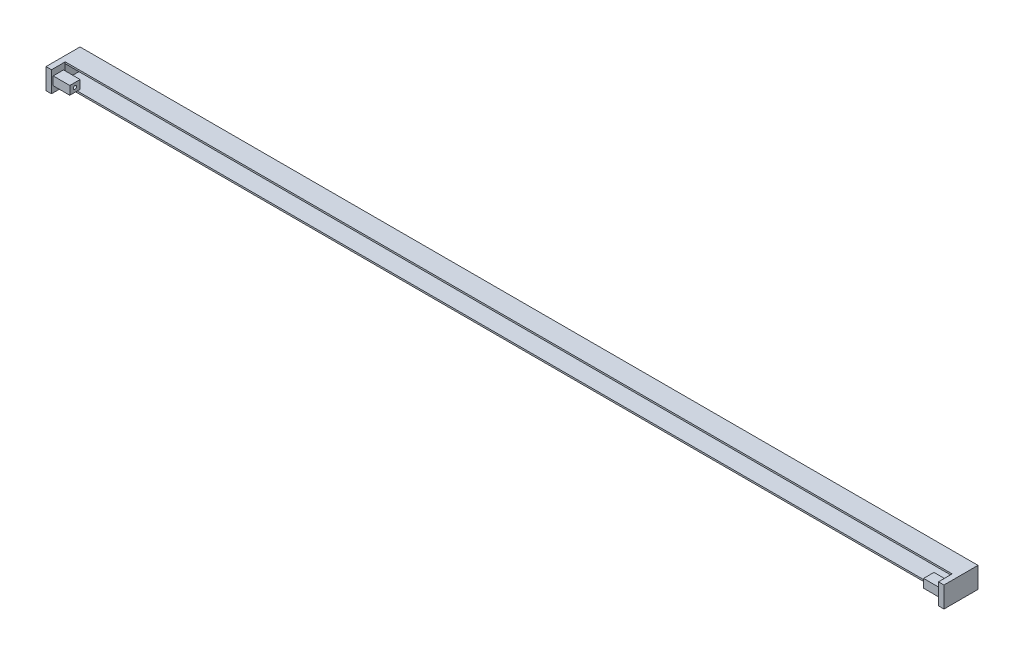
from build123d import *

# Parameters (mm, degrees)
SKETCH1_W            = 1635
SKETCH1_H            = 38
BOSS_EXTRUDE1_DEPTH  = 62
SKETCH2_W            = 1615
SKETCH2_H            = 38
CUT_EXTRUDE1_DEPTH   = 25
SKETCH3_W            = 18.796
SKETCH3_H            = 15.494
BOSS_EXTRUDE2_DEPTH  = 30.226
SKETCH5_W            = 18.91876422
SKETCH5_H            = 15.494
BOSS_EXTRUDE3_DEPTH  = 30.226
SKETCH6_R            = 3
CUT_EXTRUDE2_DEPTH   = 10
SKETCH7_R            = 3
CUT_EXTRUDE3_DEPTH   = 10
SHELL1_START         = 3
SHELL1_OUTLINE_W     = 32
SHELL1_OUTLINE_H     = 34
SHELL1_DEPTH         = 1629
SHELL1_START_2       = 1607.774
SHELL1_2_OUTLINE_W   = 9.494
SHELL1_2_OUTLINE_H   = 12.91876422
SHELL1_2_DEPTH       = 24.226
SHELL1_3_OUTLINE_W   = 9.494
SHELL1_3_OUTLINE_H   = 12.796
SHELL1_3_DEPTH       = 24.226
SHELL1_4_OUTLINE_W   = 32
SHELL1_4_OUTLINE_H   = 22
SHELL1_4_OUTLINE_W_2 = 9.494
SHELL1_4_OUTLINE_H_2 = 12.796
SHELL1_4_DEPTH       = 4
SHELL1_START_3       = 1628
SHELL1_5_OUTLINE_W   = 32
SHELL1_5_OUTLINE_H   = 22
SHELL1_5_OUTLINE_W_2 = 9.494
SHELL1_5_OUTLINE_H_2 = 12.91876422
SHELL1_5_DEPTH       = 4
SHELL1_START_4       = 1597.774
SHELL1_6_DEPTH       = 10
SHELL1_START_5       = 27.226
SHELL1_7_DEPTH       = 10


# Read off the part's stored shape, not the designer's step: Shell1
with BuildPart() as part:
    # Sketch1 → Boss-Extrude1 (new body)
    with BuildSketch(Plane.XY):
        with Locations((817.5, 19)):
            Rectangle(SKETCH1_W, SKETCH1_H)
    extrude(amount=BOSS_EXTRUDE1_DEPTH)

    # Sketch2 → Cut-Extrude1 (cut)
    with BuildSketch(Plane.XY.offset(62)):
        with Locations((817.5, 19)):
            Rectangle(SKETCH2_W, SKETCH2_H)
    extrude(amount=-CUT_EXTRUDE1_DEPTH, mode=Mode.SUBTRACT)

    # Sketch3 → Boss-Extrude2 (add)
    with BuildSketch(Plane(origin=(10, 0, 0), x_dir=(0, 0, -1), z_dir=(1, 0, 0))):
        with Locations((-49.502, 18.998)):
            Rectangle(SKETCH3_W, SKETCH3_H)
    extrude(amount=BOSS_EXTRUDE2_DEPTH)

    # Sketch5 → Boss-Extrude3 (add)
    with BuildSketch(Plane.ZY.offset(-1625)):
        with Locations((49.44061789, 18.993)):
            Rectangle(SKETCH5_W, SKETCH5_H)
    extrude(amount=BOSS_EXTRUDE3_DEPTH)

    # Sketch6 → Cut-Extrude2 (cut)
    with BuildSketch(Plane(origin=(40.226, 0, 0), x_dir=(0, 0, -1), z_dir=(1, 0, 0))):
        with Locations((-49.504, 18.996)):
            Circle(SKETCH6_R)
    extrude(amount=-CUT_EXTRUDE2_DEPTH, mode=Mode.SUBTRACT)

    # Sketch7 → Cut-Extrude3 (cut)
    with BuildSketch(Plane.ZY.offset(-1594.774)):
        with Locations((49.38123578, 18.995)):
            Circle(SKETCH7_R)
    extrude(amount=-CUT_EXTRUDE3_DEPTH, mode=Mode.SUBTRACT)

    # Shell1 outline → Shell1 (cut)
    with BuildSketch(Plane.YZ.offset(SHELL1_START)):
        with Locations((19, 20)):
            Rectangle(SHELL1_OUTLINE_W, SHELL1_OUTLINE_H)
    extrude(amount=SHELL1_DEPTH, mode=Mode.SUBTRACT)

    # Shell1 2 outline → Shell1 2 (cut)
    with BuildSketch(Plane.YZ.offset(SHELL1_START_2)):
        with Locations((18.993, 49.44061789)):
            Rectangle(SHELL1_2_OUTLINE_W, SHELL1_2_OUTLINE_H)
    extrude(amount=SHELL1_2_DEPTH, mode=Mode.SUBTRACT)

    # Shell1 3 outline → Shell1 3 (cut)
    with BuildSketch(Plane.YZ.offset(SHELL1_START)):
        with Locations((18.998, 49.502)):
            Rectangle(SHELL1_3_OUTLINE_W, SHELL1_3_OUTLINE_H)
    extrude(amount=SHELL1_3_DEPTH, mode=Mode.SUBTRACT)

    # Shell1 4 outline → Shell1 4 (cut)
    with BuildSketch(Plane.YZ.offset(SHELL1_START)):
        with Locations((19, 48)):
            Rectangle(SHELL1_4_OUTLINE_W, SHELL1_4_OUTLINE_H)
        with Locations((18.998, 49.502)):
            Rectangle(SHELL1_4_OUTLINE_W_2, SHELL1_4_OUTLINE_H_2, mode=Mode.SUBTRACT)
    extrude(amount=SHELL1_4_DEPTH, mode=Mode.SUBTRACT)

    # Shell1 5 outline → Shell1 5 (cut)
    with BuildSketch(Plane.YZ.offset(SHELL1_START_3)):
        with Locations((19, 48)):
            Rectangle(SHELL1_5_OUTLINE_W, SHELL1_5_OUTLINE_H)
        with Locations((18.993, 49.44061789)):
            Rectangle(SHELL1_5_OUTLINE_W_2, SHELL1_5_OUTLINE_H_2, mode=Mode.SUBTRACT)
    extrude(amount=SHELL1_5_DEPTH, mode=Mode.SUBTRACT)

    # Shell1 6 outline → Shell1 6 (cut)
    with BuildSketch(Plane.YZ.offset(SHELL1_START_4)):
        with BuildLine():
            Line((23.74, 55.9), (14.246, 55.9))
            Line((14.246, 55.9), (14.246, 53.048250779))
            ThreePointArc((14.246, 53.048250779), (18.991729891, 55.381234889), (23.74, 53.053425182))
            Line((23.74, 53.053425182), (23.74, 55.9))
        make_face()
        with BuildLine():
            ThreePointArc((23.74, 45.709046379), (18.991729891, 43.381236672), (14.246, 45.714220782))
            Line((14.246, 45.714220782), (14.246, 42.98123578))
            Line((14.246, 42.98123578), (23.74, 42.98123578))
            Line((23.74, 42.98123578), (23.74, 45.709046379))
        make_face()
    extrude(amount=SHELL1_6_DEPTH, mode=Mode.SUBTRACT)

    # Shell1 7 outline → Shell1 7 (cut)
    with BuildSketch(Plane.YZ.offset(SHELL1_START_5)):
        with BuildLine():
            Line((23.745, 53.171014999), (23.745, 55.9))
            Line((23.745, 55.9), (14.251, 55.9))
            Line((14.251, 55.9), (14.251, 53.176189401))
            ThreePointArc((14.251, 53.176189401), (18.999270109, 55.503999109), (23.745, 53.171014999))
        make_face()
        with BuildLine():
            Line((23.745, 43.104), (23.745, 45.836985001))
            ThreePointArc((23.745, 45.836985001), (18.999270109, 43.504000891), (14.251, 45.831810599))
            Line((14.251, 45.831810599), (14.251, 43.104))
            Line((14.251, 43.104), (23.745, 43.104))
        make_face()
    extrude(amount=SHELL1_7_DEPTH, mode=Mode.SUBTRACT)


solid = part.part
